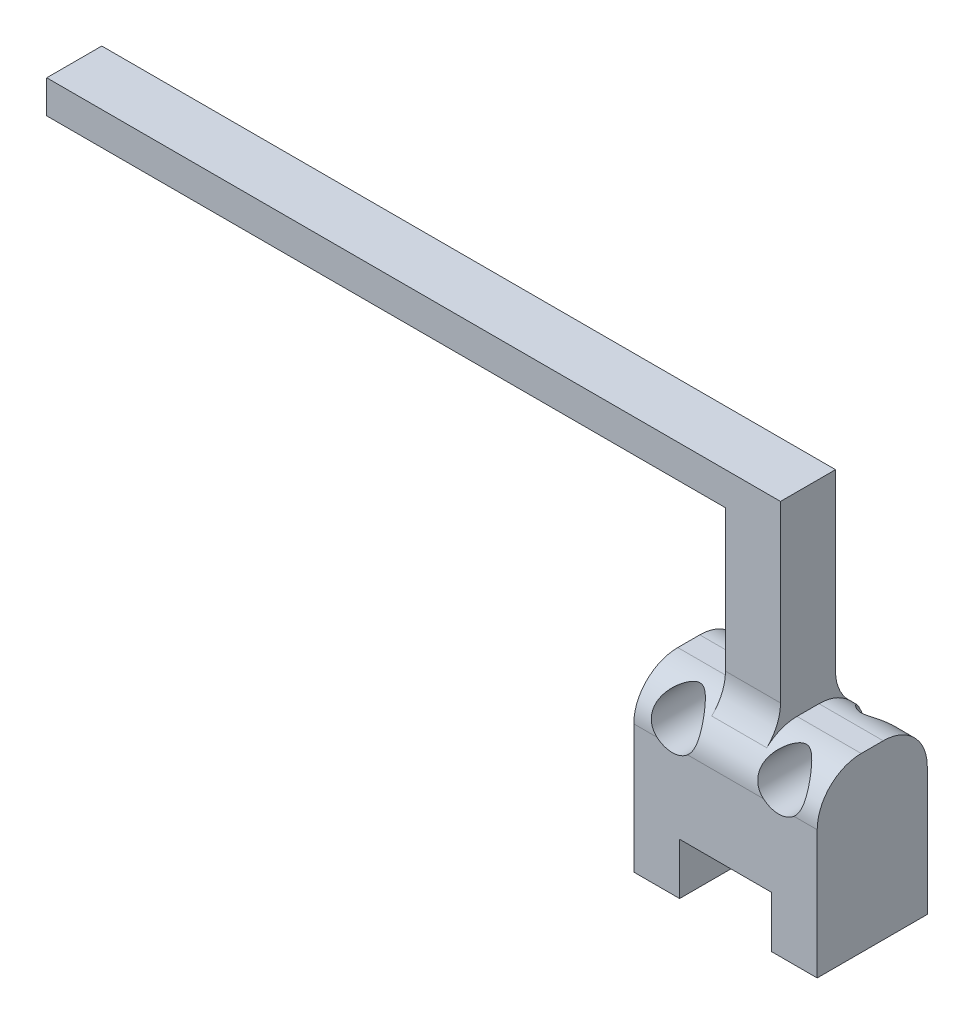
from build123d import *

# Parameters (mm, degrees)
SKETCH1_R           = 3.175
PUSHER_BASE_DEPTH   = 15
SKETCH3_R           = 1.95
SCREW_HOLE_DEPTH    = 7.5
SKETCH6_W           = 7.5
SKETCH6_H           = 26.5
PUSHER_HEAD_DEPTH   = 3.75
FILLET1_R           = 6
FILLET5_R           = 6
FILLET6_R           = 6
SKETCH8_W           = 92.5
SKETCH8_H           = 4.5
BOSS_EXTRUDE1_DEPTH = 7.5


with BuildPart() as part:
    # Sketch1 → pusher base (new body)
    with BuildSketch(Plane.XY):
        Polygon((59.166899441, -45.781018283), (51.666899441, -45.781018283), (41.666899441, -45.781018283), (34.166899441, -45.781018283), (34.166899441, -69.281018283), (40.416899441, -69.281018283), (40.416899441, -62.281018283), (52.916899441, -62.281018283), (52.916899441, -69.281018283), (59.166899441, -69.281018283), align=None)
        with Locations((39.416899441, -49.381018283)):
            Circle(SKETCH1_R, mode=Mode.SUBTRACT)
        with Locations((53.916899441, -49.381018283)):
            Circle(SKETCH1_R, mode=Mode.SUBTRACT)
    extrude(amount=PUSHER_BASE_DEPTH)

    # Sketch3 → screw hole (cut)
    with BuildSketch(Plane.XZ.offset(62.281018283)):
        with Locations(Location((46.666899441, 7.5, 0), (0, 0, 270))):
            Circle(SKETCH3_R)
    extrude(amount=-SCREW_HOLE_DEPTH, mode=Mode.SUBTRACT)

    # Sketch6 → pusher head (add, symmetric)
    with BuildSketch(Plane.XY.offset(7.5)):
        with Locations((46.666899441, -32.531018283)):
            Rectangle(SKETCH6_W, SKETCH6_H)
    extrude(amount=PUSHER_HEAD_DEPTH, both=True)

    # Fillet1
    # the kernel refuses this fillet: 6 mm, written as the material it takes off along each edge
    with BuildSketch(Plane(origin=(74.166899441, -45.781018283, 0), x_dir=(0, 0, 1), z_dir=(-1, 0, 0))) as fillet1_piece_1_section:
        with BuildLine():
            CenterArc((FILLET1_R, -FILLET1_R), FILLET1_R, 90, 90)
            Line((0, -FILLET1_R), (0, 0))
            Line((0, 0), (FILLET1_R, 0))
        make_face()
    fillet1_piece_1 = extrude(amount=55, mode=Mode.PRIVATE)
    fillet1_piece_1 = split(fillet1_piece_1, bisect_by=Plane(origin=(62.291899441, -45.824840722, 3.75), z_dir=(0, 0, 1)), keep=Keep.TOP, mode=Mode.PRIVATE)
    fillet1_piece_1 = split(fillet1_piece_1, bisect_by=Plane(origin=(50.416899441, -45.824840722, 4.566140917), z_dir=(1, 0, 0)), keep=Keep.TOP, mode=Mode.PRIVATE)
    add(fillet1_piece_1, mode=Mode.SUBTRACT)
    with BuildSketch(Plane(origin=(74.166899441, -45.781018283, 0), x_dir=(0, 0, 1), z_dir=(-1, 0, 0))) as fillet1_piece_2_section:
        with BuildLine():
            CenterArc((FILLET1_R, -FILLET1_R), FILLET1_R, 90, 90)
            Line((0, -FILLET1_R), (0, 0))
            Line((0, 0), (FILLET1_R, 0))
        make_face()
    fillet1_piece_2 = extrude(amount=55, mode=Mode.PRIVATE)
    fillet1_piece_2 = split(fillet1_piece_2, bisect_by=Plane(origin=(62.291899441, -47.230240291, 3.75), z_dir=(0, 0, -1)), keep=Keep.TOP, mode=Mode.PRIVATE)
    fillet1_piece_2 = split(fillet1_piece_2, bisect_by=Plane(origin=(50.416899441, -47.230240291, 1.136674626), z_dir=(1, 0, 0)), keep=Keep.TOP, mode=Mode.PRIVATE)
    add(fillet1_piece_2, mode=Mode.SUBTRACT)
    with BuildSketch(Plane(origin=(74.166899441, -45.781018283, 0), x_dir=(0, 0, 1), z_dir=(-1, 0, 0))) as fillet1_piece_3_section:
        with BuildLine():
            CenterArc((FILLET1_R, -FILLET1_R), FILLET1_R, 90, 90)
            Line((0, -FILLET1_R), (0, 0))
            Line((0, 0), (FILLET1_R, 0))
        make_face()
    fillet1_piece_3 = extrude(amount=55, mode=Mode.PRIVATE)
    fillet1_piece_3 = split(fillet1_piece_3, bisect_by=Plane(origin=(46.666899441, -47.230240291, 3.75), z_dir=(0, 0, -1)), keep=Keep.TOP, mode=Mode.PRIVATE)
    fillet1_piece_3 = split(fillet1_piece_3, bisect_by=Plane(origin=(50.416899441, -47.230240291, 1.136674626), z_dir=(-1, 0, 0)), keep=Keep.TOP, mode=Mode.PRIVATE)
    fillet1_piece_3 = split(fillet1_piece_3, bisect_by=Plane(origin=(42.916899441, -47.230240291, 1.136674626), z_dir=(1, 0, 0)), keep=Keep.TOP, mode=Mode.PRIVATE)
    add(fillet1_piece_3, mode=Mode.SUBTRACT)
    with BuildSketch(Plane(origin=(74.166899441, -45.781018283, 0), x_dir=(0, 0, 1), z_dir=(-1, 0, 0))) as fillet1_piece_4_section:
        with BuildLine():
            CenterArc((FILLET1_R, -FILLET1_R), FILLET1_R, 90, 90)
            Line((0, -FILLET1_R), (0, 0))
            Line((0, 0), (FILLET1_R, 0))
        make_face()
    fillet1_piece_4 = extrude(amount=55, mode=Mode.PRIVATE)
    fillet1_piece_4 = split(fillet1_piece_4, bisect_by=Plane(origin=(31.041899441, -45.824840722, 3.75), z_dir=(0, 0, 1)), keep=Keep.TOP, mode=Mode.PRIVATE)
    fillet1_piece_4 = split(fillet1_piece_4, bisect_by=Plane(origin=(42.916899441, -45.824840722, 4.566140917), z_dir=(-1, 0, 0)), keep=Keep.TOP, mode=Mode.PRIVATE)
    add(fillet1_piece_4, mode=Mode.SUBTRACT)
    with BuildSketch(Plane(origin=(74.166899441, -45.781018283, 0), x_dir=(0, 0, 1), z_dir=(-1, 0, 0))) as fillet1_piece_5_section:
        with BuildLine():
            CenterArc((FILLET1_R, -FILLET1_R), FILLET1_R, 90, 90)
            Line((0, -FILLET1_R), (0, 0))
            Line((0, 0), (FILLET1_R, 0))
        make_face()
    fillet1_piece_5 = extrude(amount=55, mode=Mode.PRIVATE)
    fillet1_piece_5 = split(fillet1_piece_5, bisect_by=Plane(origin=(31.041899441, -47.230240291, 3.75), z_dir=(0, 0, -1)), keep=Keep.TOP, mode=Mode.PRIVATE)
    fillet1_piece_5 = split(fillet1_piece_5, bisect_by=Plane(origin=(42.916899441, -47.230240291, 1.136674626), z_dir=(-1, 0, 0)), keep=Keep.TOP, mode=Mode.PRIVATE)
    add(fillet1_piece_5, mode=Mode.SUBTRACT)
    with BuildSketch(Plane(origin=(19.166899441, -45.781018283, 15), x_dir=(0, 0, -1), z_dir=(1, 0, 0))) as fillet1_piece_6_section:
        with BuildLine():
            CenterArc((FILLET1_R, -FILLET1_R), FILLET1_R, 90, 90)
            Line((0, -FILLET1_R), (0, 0))
            Line((0, 0), (FILLET1_R, 0))
        make_face()
    fillet1_piece_6 = extrude(amount=55, mode=Mode.PRIVATE)
    fillet1_piece_6 = split(fillet1_piece_6, bisect_by=Plane(origin=(31.041899441, -45.824840722, 11.25), z_dir=(0, 0, -1)), keep=Keep.TOP, mode=Mode.PRIVATE)
    fillet1_piece_6 = split(fillet1_piece_6, bisect_by=Plane(origin=(42.916899441, -45.824840722, 10.433859083), z_dir=(-1, 0, 0)), keep=Keep.TOP, mode=Mode.PRIVATE)
    add(fillet1_piece_6, mode=Mode.SUBTRACT)
    with BuildSketch(Plane(origin=(19.166899441, -45.781018283, 15), x_dir=(0, 0, -1), z_dir=(1, 0, 0))) as fillet1_piece_7_section:
        with BuildLine():
            CenterArc((FILLET1_R, -FILLET1_R), FILLET1_R, 90, 90)
            Line((0, -FILLET1_R), (0, 0))
            Line((0, 0), (FILLET1_R, 0))
        make_face()
    fillet1_piece_7 = extrude(amount=55, mode=Mode.PRIVATE)
    fillet1_piece_7 = split(fillet1_piece_7, bisect_by=Plane(origin=(31.041899441, -47.230240291, 11.25), z_dir=(0, 0, 1)), keep=Keep.TOP, mode=Mode.PRIVATE)
    fillet1_piece_7 = split(fillet1_piece_7, bisect_by=Plane(origin=(42.916899441, -47.230240291, 13.863325374), z_dir=(-1, 0, 0)), keep=Keep.TOP, mode=Mode.PRIVATE)
    add(fillet1_piece_7, mode=Mode.SUBTRACT)
    with BuildSketch(Plane(origin=(19.166899441, -45.781018283, 15), x_dir=(0, 0, -1), z_dir=(1, 0, 0))) as fillet1_piece_8_section:
        with BuildLine():
            CenterArc((FILLET1_R, -FILLET1_R), FILLET1_R, 90, 90)
            Line((0, -FILLET1_R), (0, 0))
            Line((0, 0), (FILLET1_R, 0))
        make_face()
    fillet1_piece_8 = extrude(amount=55, mode=Mode.PRIVATE)
    fillet1_piece_8 = split(fillet1_piece_8, bisect_by=Plane(origin=(50.416899441, -47.230240291, 13.863325374), z_dir=(-1, 0, 0)), keep=Keep.TOP, mode=Mode.PRIVATE)
    fillet1_piece_8 = split(fillet1_piece_8, bisect_by=Plane(origin=(46.666899441, -47.230240291, 11.25), z_dir=(0, 0, 1)), keep=Keep.TOP, mode=Mode.PRIVATE)
    fillet1_piece_8 = split(fillet1_piece_8, bisect_by=Plane(origin=(42.916899441, -47.230240291, 13.863325374), z_dir=(1, 0, 0)), keep=Keep.TOP, mode=Mode.PRIVATE)
    add(fillet1_piece_8, mode=Mode.SUBTRACT)
    with BuildSketch(Plane(origin=(19.166899441, -45.781018283, 15), x_dir=(0, 0, -1), z_dir=(1, 0, 0))) as fillet1_piece_9_section:
        with BuildLine():
            CenterArc((FILLET1_R, -FILLET1_R), FILLET1_R, 90, 90)
            Line((0, -FILLET1_R), (0, 0))
            Line((0, 0), (FILLET1_R, 0))
        make_face()
    fillet1_piece_9 = extrude(amount=55, mode=Mode.PRIVATE)
    fillet1_piece_9 = split(fillet1_piece_9, bisect_by=Plane(origin=(50.416899441, -45.824840722, 10.433859083), z_dir=(1, 0, 0)), keep=Keep.TOP, mode=Mode.PRIVATE)
    fillet1_piece_9 = split(fillet1_piece_9, bisect_by=Plane(origin=(62.291899441, -45.824840722, 11.25), z_dir=(0, 0, -1)), keep=Keep.TOP, mode=Mode.PRIVATE)
    add(fillet1_piece_9, mode=Mode.SUBTRACT)
    with BuildSketch(Plane(origin=(19.166899441, -45.781018283, 15), x_dir=(0, 0, -1), z_dir=(1, 0, 0))) as fillet1_piece_10_section:
        with BuildLine():
            CenterArc((FILLET1_R, -FILLET1_R), FILLET1_R, 90, 90)
            Line((0, -FILLET1_R), (0, 0))
            Line((0, 0), (FILLET1_R, 0))
        make_face()
    fillet1_piece_10 = extrude(amount=55, mode=Mode.PRIVATE)
    fillet1_piece_10 = split(fillet1_piece_10, bisect_by=Plane(origin=(50.416899441, -47.230240291, 13.863325374), z_dir=(1, 0, 0)), keep=Keep.TOP, mode=Mode.PRIVATE)
    fillet1_piece_10 = split(fillet1_piece_10, bisect_by=Plane(origin=(62.291899441, -47.230240291, 11.25), z_dir=(0, 0, 1)), keep=Keep.TOP, mode=Mode.PRIVATE)
    add(fillet1_piece_10, mode=Mode.SUBTRACT)

    # Fillet5
    fillet5_edges = [part.edges().sort_by_distance(p)[0] for p in [
        (46.666899441, -46.218869418, 11.25),
    ]]
    fillet(fillet5_edges, radius=FILLET5_R)

    # Fillet6
    fillet6_edges = [part.edges().sort_by_distance(p)[0] for p in [
        (46.666899441, -46.218869418, 3.75),
    ]]
    fillet(fillet6_edges, radius=FILLET6_R)

    # Sketch8 → Boss-Extrude1 (add)
    with BuildSketch(Plane(origin=(0, 0, 3.75), x_dir=(-1, 0, 0), z_dir=(0, 0, -1))):
        with Locations((3.333100559, -21.531018283)):
            Rectangle(SKETCH8_W, SKETCH8_H)
    extrude(amount=-BOSS_EXTRUDE1_DEPTH)


solid = part.part
